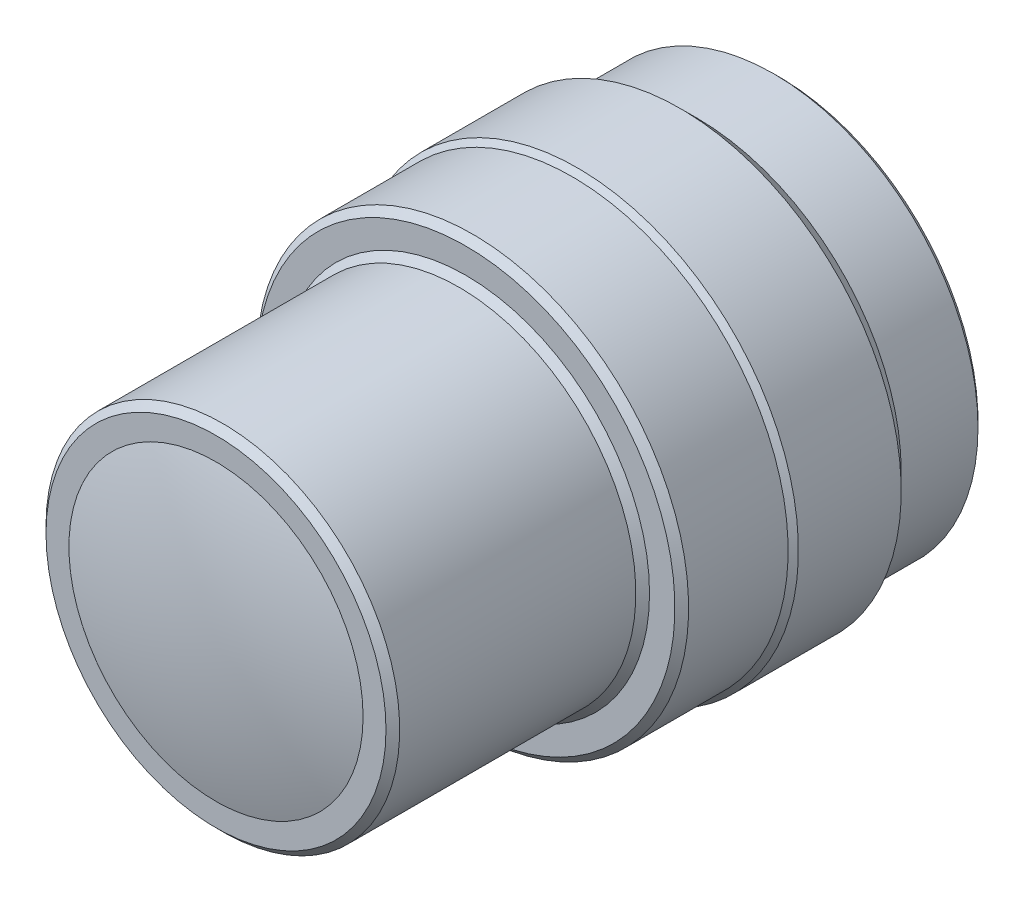
from build123d import *


with BuildPart() as part:
    # Эскиз1 → Повернуть1 (revolve)
    with BuildSketch(Plane(origin=(0, 0, 0), x_dir=(1, 0, 0), z_dir=(0, 1, 0))):
        Polygon((0, 0), (12.7, 0), (12.7, -3), (15, -3), (15, -4), (29, -4), (29.8, -4.8), (29.8, -16), (32.25, -18.45), (32.25, -33.45), (31.5, -34.2), (31.5, -48.72), (30.5, -49.72), (26.8, -49.72), (25.8, -50.72), (25.8, -85.17), (24.8, -86.17), (0, -86.17), align=None)
    revolve(axis=Axis((0, 0, 0), (0, 0, 1)))

    # Эскиз2 → Повернуть2 (revolve)
    with BuildSketch(Plane(origin=(0, 0, 0), x_dir=(1, 0, 0), z_dir=(0, 1, 0))):
        with BuildLine():
            Line((0, -86.17), (0, -89.17))
            ThreePointArc((0, -89.17), (10.83404162, -88.416370928), (21.459399602, -86.17))
            Line((21.459399602, -86.17), (0, -86.17))
        make_face()
    revolve(axis=Axis((0, 0, 2.482382031), (0, 0, -1)))


solid = part.part
